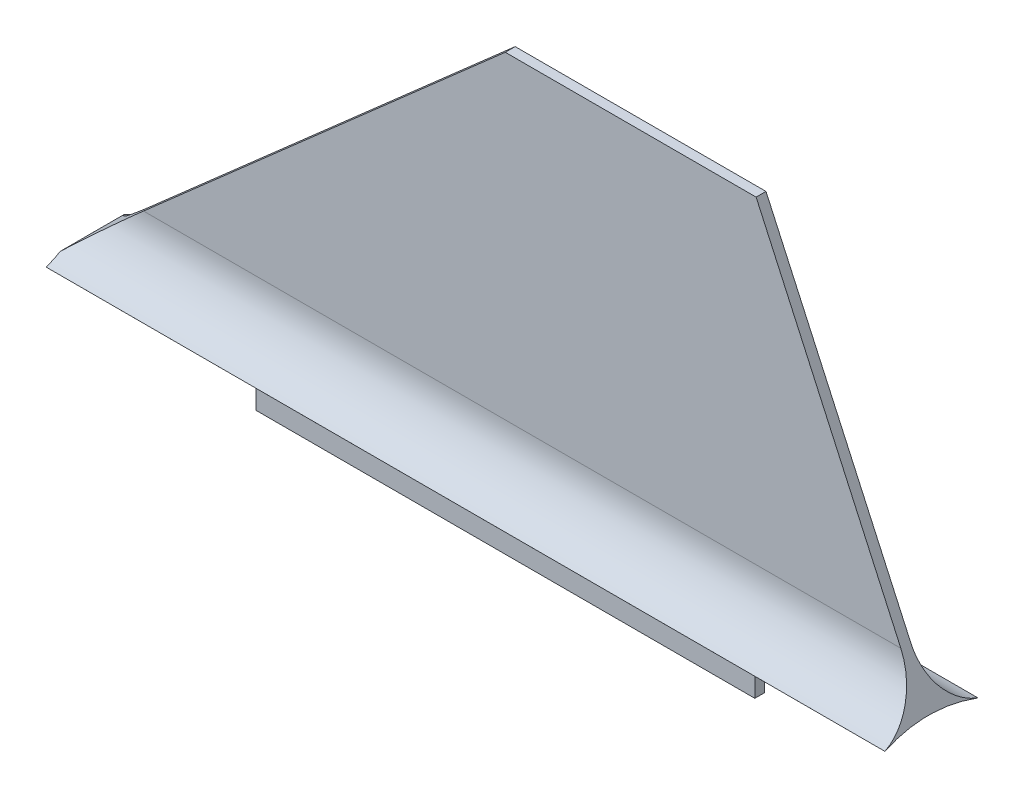
from build123d import *

# Parameters (mm, degrees)
BOSS_EXTRUDE1_DEPTH = 2.9972
EXTRUDE_THIN1_REACH = 279.516
FILLET1_R           = 17.78


with BuildPart() as part:
    # Sketch1 → Boss-Extrude1 (new body)
    with BuildSketch(Plane.XY):
        Polygon((0, 0), (127, 111.76), (203.2, 111.76), (254, 0), (202.8063, 0), (202.8063, -20.32), (51.1937, -20.32), (51.1937, 0), align=None)
    extrude(amount=BOSS_EXTRUDE1_DEPTH)

    # Extrude-Thin1: up to this plane
    extrude_thin1_end = Plane(origin=(203.2, 111.76, 2.9972), z_dir=(-0.9103664774625979, -0.41380294430119924, 0))
    # Sketch2 → Extrude-Thin1 (add, up to the surface)
    with BuildSketch(Plane(origin=(0, 0, 0), x_dir=(0, 0, -1), z_dir=(1, 0, 0)), mode=Mode.PRIVATE) as extrude_thin1_sk1:
        with BuildLine():
            ThreePointArc((12.7, -2.002489682), (-1.419520366, 0.02204761), (-15.545275431, -1.958520612))
            Line((-15.545275431, -1.958520612), (-15.544573097, -1.96096158))
            ThreePointArc((-15.544573097, -1.96096158), (-1.41952432, 0.019507613), (12.69929007, -2.004928452))
            Line((12.69929007, -2.004928452), (12.7, -2.002489682))
        make_face()
    extrude_thin1_tool1 = split(extrude(extrude_thin1_sk1.sketch, amount=EXTRUDE_THIN1_REACH, mode=Mode.PRIVATE), bisect_by=extrude_thin1_end, keep=Keep.BOTH, mode=Mode.PRIVATE)
    add(extrude_thin1_tool1.solids().sort_by_distance((0, -1.92456, -12.427752))[0])

    # Fillet1
    # the kernel refuses this fillet: 17.78 mm, written as the material it adds along each edge
    with BuildSketch(Plane(origin=(0, 0, 0), x_dir=(0, 1, 0), z_dir=(1, 0, 0))) as fillet1_piece_1_section:
        with BuildLine():
            CenterArc((15.036348307, -17.78), FILLET1_R, 90, 73.398450401)
            ThreePointArc((-2.002489682, -12.7), (-0.597845135, -6.413606594), (0, 0))
            Line((0, 0), (15.036348307, 0))
        make_face()
    fillet1_piece_1 = extrude(amount=291.590870767, mode=Mode.PRIVATE)
    fillet1_piece_1 = split(fillet1_piece_1, bisect_by=Plane(origin=(74.006923082, 65.126092312, -3.495773927), z_dir=(0.6606278948920264, -0.750713516922754, 0)), keep=Keep.TOP, mode=Mode.PRIVATE)
    fillet1_piece_1 = split(fillet1_piece_1, bisect_by=Plane(origin=(230.677770328, 51.308905278, -3.495773927), z_dir=(-0.9103664774625979, -0.41380294430119924, 0)), keep=Keep.TOP, mode=Mode.PRIVATE)
    add(fillet1_piece_1)
    with BuildSketch(Plane(origin=(291.585706816, 0, 2.9972), x_dir=(0, -0.15421422141514082, 0.9880374354817341), z_dir=(-1, 0, 0))) as fillet1_piece_2_section:
        with BuildLine():
            CenterArc((15.248805398, 17.596363006), FILLET1_R, 188.871226526, 72.886892423)
            Line((-2.318500205, 14.854434149), (0, 0))
            ThreePointArc((0, 0), (6.35, 0.398437524), (12.7, 0))
        make_face()
    fillet1_piece_2 = extrude(amount=291.585706816, mode=Mode.PRIVATE)
    fillet1_piece_2 = split(fillet1_piece_2, bisect_by=Plane(origin=(74.031944404, 65.148111076, 6.44558698), z_dir=(0.6606278948920264, -0.750713516922754, 0)), keep=Keep.TOP, mode=Mode.PRIVATE)
    fillet1_piece_2 = split(fillet1_piece_2, bisect_by=Plane(origin=(230.652775468, 51.36389397, 6.44558698), z_dir=(-0.9103664774625979, -0.41380294430119924, 0)), keep=Keep.TOP, mode=Mode.PRIVATE)
    add(fillet1_piece_2)


solid = part.part
